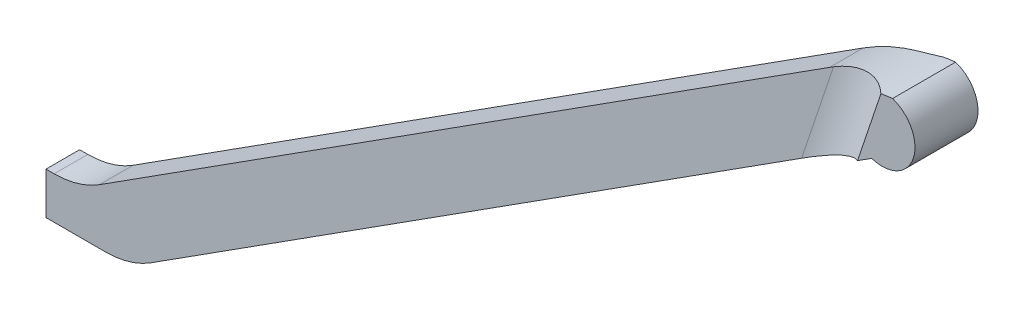
from build123d import *

# Parameters (mm, degrees)
BOSS_EXTRUDE1_DEPTH     = 0.4
BOSS_EXTRUDE2_START     = -0.1
BOSS_EXTRUDE2_DEPTH     = 0.75
FILLET1_R               = 2
FILLET2_R               = 2
CUT_EXTRUDE1_DEPTH      = 26.275598114
CUT_EXTRUDE1_DEPTH_BACK = 26.275598114
FILLET3_R               = 5
BOSS_EXTRUDE4_DEPTH     = 1.5


with BuildPart() as part:
    # Sketch1 → Boss-Extrude1 (new, symmetric)
    with BuildSketch(Plane.XY):
        Polygon((0, 0), (2, 0), (20.294681103, 11.693172413), (21.054279514, 13.958892298), (0.779302489, 1), (0, 1), align=None)
    extrude(amount=BOSS_EXTRUDE1_DEPTH, both=True)

    # Sketch2 → Boss-Extrude2 (add, symmetric)
    with BuildSketch(Plane.XY.offset(0.4).offset(BOSS_EXTRUDE2_START)):
        Polygon((21.054279514, 13.958892298), (20.717242005, 13.743472434), (19.957643594, 11.47775255), (20.294681103, 11.693172413), align=None)
    extrude(amount=BOSS_EXTRUDE2_DEPTH, both=True)

    # Fillet1
    fillet1_edges = [part.edges().sort_by_distance(p)[0] for p in [
        (0.779302489, 1, 0),
        (2, 0, 0),
    ]]
    fillet(fillet1_edges, radius=FILLET1_R)

    # Fillet2
    # the kernel refuses this fillet: 2 mm, written as the material it adds along each edge
    with BuildSketch(Plane(origin=(21.070401948, 14.796873144, -0.4), x_dir=(-0.9481347144095073, 0.31786878319772466, 0), z_dir=(-0.3178687831977247, -0.9481347144095074, 0))) as fillet2_piece_1_section:
        with BuildLine():
            CenterArc((0.444409721, 2), FILLET2_R, 257.161431859, 12.838568141)
            Line((0, 0.05), (0, 0))
            Line((0, 0), (0.444409721, 0))
        make_face()
    fillet2_piece_1 = extrude(amount=4.611708902, mode=Mode.PRIVATE)
    fillet2_piece_1 = split(fillet2_piece_1, bisect_by=Plane(origin=(21.445983631, 14.209252703, -0.4), z_dir=(0.5385496583097051, -0.8425937725467118, 0)), keep=Keep.TOP, mode=Mode.PRIVATE)
    fillet2_piece_1 = split(fillet2_piece_1, bisect_by=Plane(origin=(22.253808119, 12.945362044, -0.4), z_dir=(-0.538549658309705, 0.8425937725467119, 0)), keep=Keep.TOP, mode=Mode.PRIVATE)
    add(fillet2_piece_1)
    with BuildSketch(Plane(origin=(21.889888122, 17.241225439, 0.4), x_dir=(-0.9481347144095071, 0.3178687831977246, 0), z_dir=(-0.3178687831977247, -0.9481347144095074, 0))) as fillet2_piece_2_section:
        with BuildLine():
            CenterArc((1.475635456, -2), FILLET2_R, 90, 47.545849796)
            Line((0, -0.65), (0, 0))
            Line((0, 0), (1.475635456, 0))
        make_face()
    fillet2_piece_2 = extrude(amount=9.76783758, mode=Mode.PRIVATE)
    fillet2_piece_2 = split(fillet2_piece_2, bisect_by=Plane(origin=(23.136984265, 15.290067496, 0.4), z_dir=(0.5385496583097051, -0.8425937725467118, 0)), keep=Keep.TOP, mode=Mode.PRIVATE)
    fillet2_piece_2 = split(fillet2_piece_2, bisect_by=Plane(origin=(23.944808753, 14.026176837, 0.4), z_dir=(-0.538549658309705, 0.8425937725467119, 0)), keep=Keep.TOP, mode=Mode.PRIVATE)
    add(fillet2_piece_2)

    # Sketch4 → Cut-Extrude1 (cut, two sides: drawn at the far end of the back side and taken through both)
    with BuildSketch(Plane.XY.offset(0.4).offset(-CUT_EXTRUDE1_DEPTH_BACK)):
        Polygon((17.612630282, 13.011216265), (21.976187612, 13.235824871), (21.976187612, 14.520118874), (17.612630282, 14.232504072), align=None)
    extrude(amount=CUT_EXTRUDE1_DEPTH + CUT_EXTRUDE1_DEPTH_BACK, mode=Mode.SUBTRACT)

    # Fillet3
    # the kernel refuses this fillet: 5 mm, written as the material it takes off along each edge
    with BuildSketch(Plane(origin=(19.743162439, 13.120882718, -3.665218242), x_dir=(-0.8425937725466615, -0.5385496583097837, 0), z_dir=(0, 0, 1))) as fillet3_piece_1:
        with BuildLine():
            CenterArc((1.306087297, 5), FILLET3_R, 243.661056807, 26.338943193)
            Line((-0.912314796, 0.519074632), (-0.956682838, 0.429456124))
            ThreePointArc((-0.956682838, 0.429456124), (-0.505609749, 0.172620891), (-0.049452351, -0.086916425))
            Line((-0.049452351, -0.086916425), (0, -0.1))
            Line((0, -0.1), (1.306087297, -0.1))
            Line((1.306087297, -0.1), (1.306087297, 0))
        make_face()
    extrude(amount=7.476378223, mode=Mode.SUBTRACT)

    # Sketch5 → Boss-Extrude4 (add)
    with BuildSketch(Plane.XY.offset(1.05)):
        with BuildLine():
            Line((20.79142067, 13.174840488), (20.294681103, 11.693172413))
            ThreePointArc((20.294681103, 11.693172413), (21.283884924, 12.185636667), (20.79142067, 13.174840488))
        make_face()
    extrude(amount=-BOSS_EXTRUDE4_DEPTH)


solid = part.part
